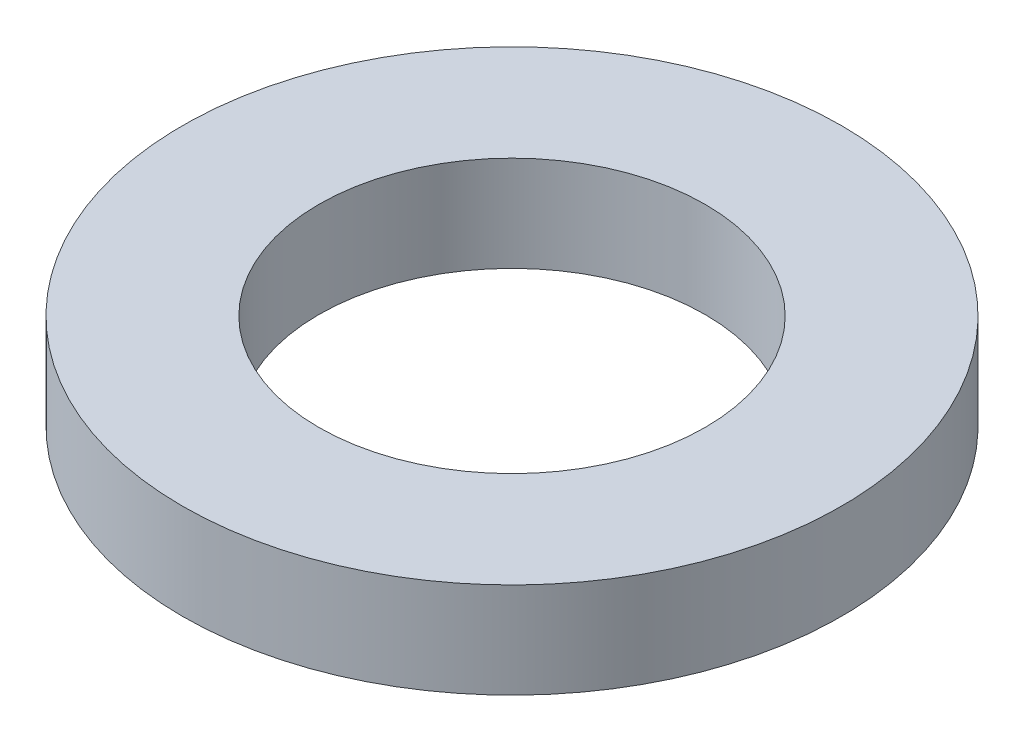
from build123d import *

# Parameters (mm, degrees)
SKETCH1_R           = 72.5
BOSS_EXTRUDE1_DEPTH = 21
SKETCH2_R           = 42.5
CUT_EXTRUDE1_DEPTH  = 105.658969993


with BuildPart() as part:
    # Sketch1 → Boss-Extrude1 (new body)
    with BuildSketch(Plane(origin=(0, 0, 0), x_dir=(1, 0, 0), z_dir=(0, 1, 0))):
        Circle(SKETCH1_R)
    extrude(amount=BOSS_EXTRUDE1_DEPTH)

    # Sketch2 → Cut-Extrude1 (cut, through all)
    with BuildSketch(Plane(origin=(0, 0, 0), x_dir=(1, 0, 0), z_dir=(0, 1, 0))):
        Circle(SKETCH2_R)
    extrude(amount=CUT_EXTRUDE1_DEPTH, mode=Mode.SUBTRACT)


solid = part.part
